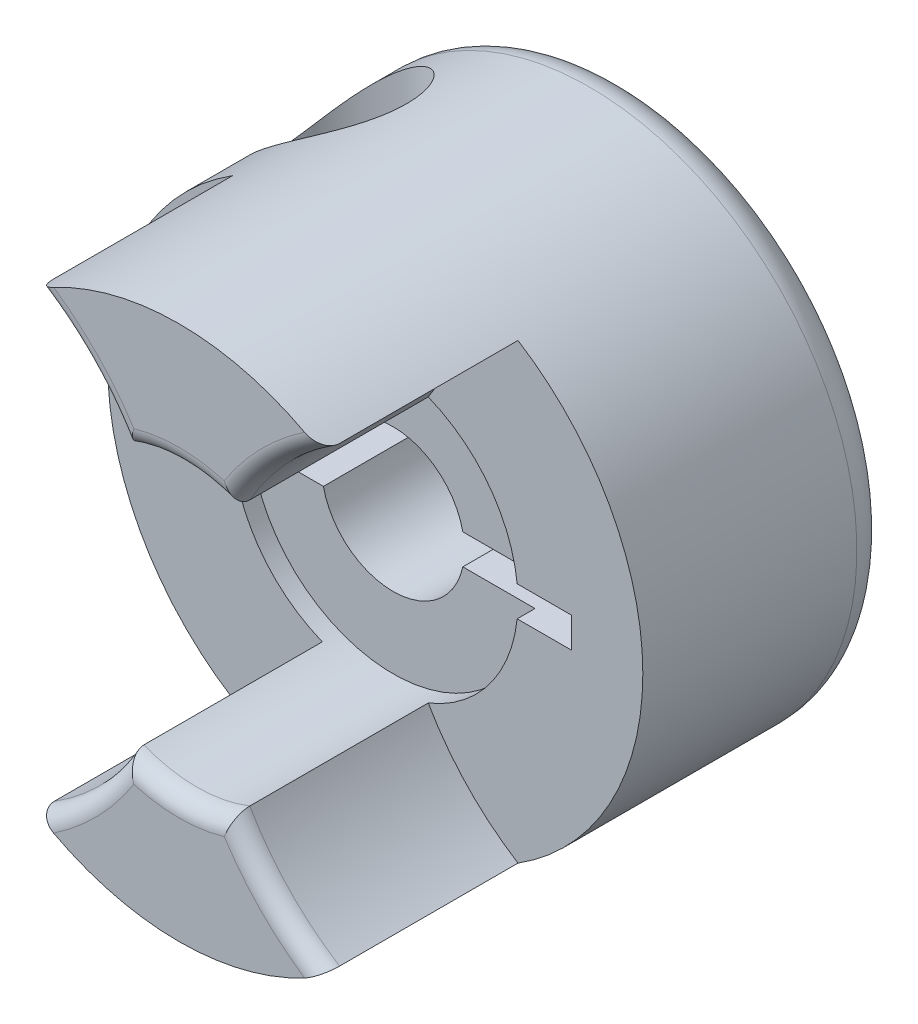
from build123d import *

# Parameters (mm, degrees)
SKETCH1_R               = 15
BOSS_EXTRUDE1_DEPTH     = 25
CUT_EXTRUDE1_DEPTH      = 11
SKETCH4_R               = 4
CUT_EXTRUDE2_DEPTH      = 14
SKETCH5_R               = 8
CUT_EXTRUDE3_DEPTH      = 1
SKETCH6_W               = 28.841933153
SKETCH6_H               = 1.7
CUT_EXTRUDE4_DEPTH      = 14
SKETCH7_W               = 7.091355734
SKETCH7_H               = 1.7
BOSS_EXTRUDE2_DEPTH     = 2
CHAMFER1_SIZE           = 11
CUT_EXTRUDE5_DEPTH      = 14
CUT_EXTRUDE5_DEPTH_BACK = 14
SKETCH8_R               = 2
SKETCH9_R               = 3.75
CUT_EXTRUDE6_DEPTH      = 11
FILLET1_R               = 2
FILLET2_R               = 1


with BuildPart() as part:
    # Sketch1 → Boss-Extrude1 (new body)
    with BuildSketch(Plane.XY):
        Circle(SKETCH1_R)
    extrude(amount=BOSS_EXTRUDE1_DEPTH)

    # Sketch3 → Cut-Extrude1 (cut)
    with BuildSketch(Plane.XY.offset(25)):
        with BuildLine():
            ThreePointArc((2.96875, -7.428763251), (31, 0), (2.96875, 7.428763251))
            ThreePointArc((2.96875, 7.428763251), (0, 8), (-2.96875, 7.428763251))
            ThreePointArc((-2.96875, 7.428763251), (-31, 0), (-2.96875, -7.428763251))
            ThreePointArc((-2.96875, -7.428763251), (0, -8), (2.96875, -7.428763251))
        make_face()
    extrude(amount=-CUT_EXTRUDE1_DEPTH, mode=Mode.SUBTRACT)

    # Sketch4 → Cut-Extrude2 (cut)
    with BuildSketch(Plane.XY.offset(14)):
        Circle(SKETCH4_R)
    extrude(amount=-CUT_EXTRUDE2_DEPTH, mode=Mode.SUBTRACT)

    # Sketch5 → Cut-Extrude3 (cut)
    with BuildSketch(Plane.XY.offset(14)):
        Circle(SKETCH5_R)
    extrude(amount=-CUT_EXTRUDE3_DEPTH, mode=Mode.SUBTRACT)

    # Sketch6 → Cut-Extrude4 (cut)
    with BuildSketch(Plane.XY.offset(14)):
        with Locations((-3.420966576, 0)):
            Rectangle(SKETCH6_W, SKETCH6_H)
    extrude(amount=-CUT_EXTRUDE4_DEPTH, mode=Mode.SUBTRACT)

    # Sketch7 → Boss-Extrude2 (add)
    with BuildSketch(Plane(origin=(0, 0, 0), x_dir=(-1, 0, 0), z_dir=(0, 0, -1))):
        with Locations((-7.454322133, 0)):
            Rectangle(SKETCH7_W, SKETCH7_H)
    extrude(amount=-BOSS_EXTRUDE2_DEPTH)

    # Chamfer1
    # the kernel refuses this chamfer: 11 mm, written as the material it adds along each edge
    with BuildSketch(Plane(origin=(11, -0.85, 2), x_dir=(0.027495876610586414, 0, 0.9996219169112968), z_dir=(0, 1, 0))) as chamfer1_piece_1_section:
        Polygon((CHAMFER1_SIZE * 0.999621916911, -CHAMFER1_SIZE * 0.0274958766106), (-CHAMFER1_SIZE * 0.0274958766106, -CHAMFER1_SIZE * 0.999621916911), (0, 0), align=None)
    chamfer1_piece_1 = extrude(amount=1.7, mode=Mode.PRIVATE)
    chamfer1_piece_1 = split(chamfer1_piece_1, bisect_by=Plane(origin=(3.908644266, 0, 6.042844173), z_dir=(1, 0, 0)), keep=Keep.TOP, mode=Mode.PRIVATE)
    add(chamfer1_piece_1)

    # Sketch8 → Cut-Extrude5 (cut, two sides: drawn at the far end of the back side and taken through both)
    with BuildSketch(Plane(origin=(0, 0, 0), x_dir=(1, 0, 0), z_dir=(0, 1, 0)).offset(-CUT_EXTRUDE5_DEPTH_BACK)):
        with Locations(Location((-9, -7, 0), (0, 0, 90))):
            Circle(SKETCH8_R)
    extrude(amount=CUT_EXTRUDE5_DEPTH + CUT_EXTRUDE5_DEPTH_BACK, mode=Mode.SUBTRACT)

    # Sketch9 → Cut-Extrude6 (cut)
    with BuildSketch(Plane(origin=(0, 15, 0), x_dir=(1, 0, 0), z_dir=(0, 1, 0))):
        with Locations(Location((-9, -7, 0), (0, 0, 270))):
            Circle(SKETCH9_R)
    extrude(amount=-CUT_EXTRUDE6_DEPTH, mode=Mode.SUBTRACT)

    # Fillet1
    fillet1_edges = [part.edges().sort_by_distance(p)[0] for p in [
        (15, 0, 0),
    ]]
    fillet(fillet1_edges, radius=FILLET1_R)

    # Fillet2
    fillet2_edges = [part.edges().sort_by_distance(p)[0] for p in [
        (-5.160499055, 10.368472369, 25),
        (0, -8, 25),
        (5.160499055, -10.368472369, 25),
        (0, 8, 25),
        (-5.160499055, -10.368472369, 25),
        (5.160499055, 10.368472369, 25),
    ]]
    fillet(fillet2_edges, radius=FILLET2_R)


solid = part.part
